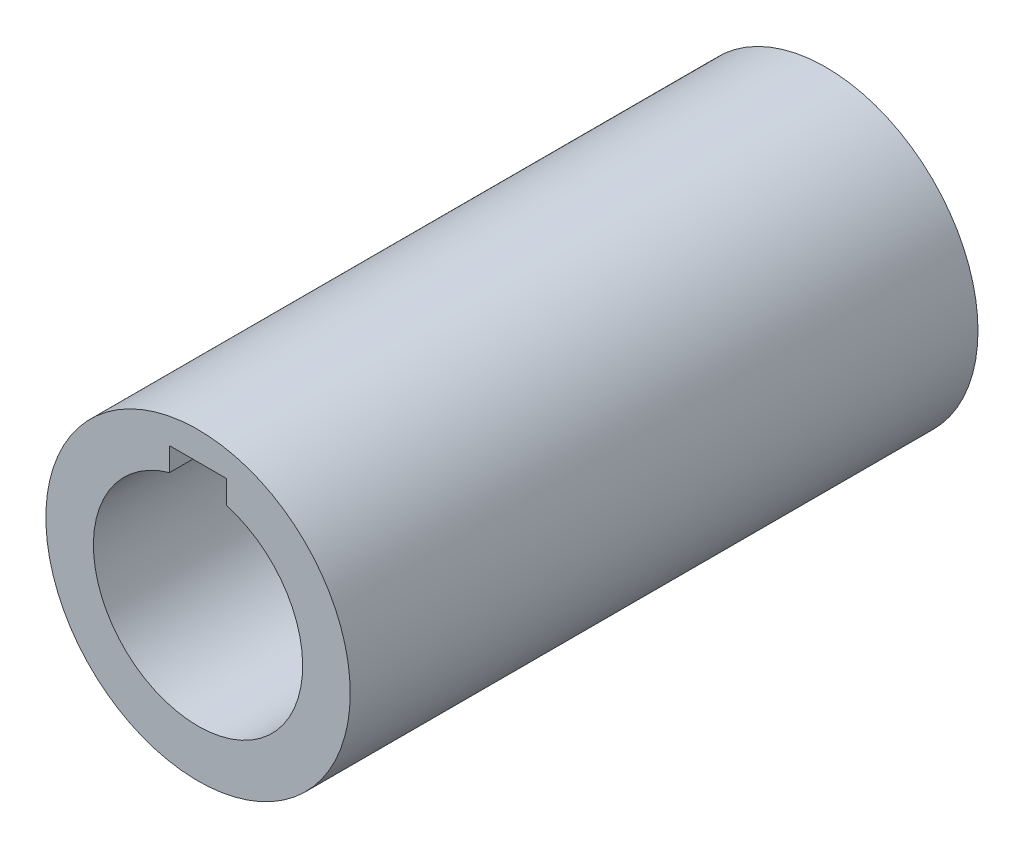
from build123d import *

# Parameters (mm, degrees)
BOSS_EXTRUDE1_DEPTH      = 33
BOSS_EXTRUDE1_DEPTH_BACK = 33
SKETCH1_R                = 16
SKETCH1_R_2              = 11
CUT_EXTRUDE1_DEPTH       = 33


with BuildPart() as part:
    # Sketch1 → Boss-Extrude1 (new, two sides: drawn at the far end of the back side and taken through both)
    with BuildSketch(Plane.XY.offset(-BOSS_EXTRUDE1_DEPTH_BACK)):
        Circle(SKETCH1_R)
        Circle(SKETCH1_R_2, mode=Mode.SUBTRACT)
    extrude(amount=BOSS_EXTRUDE1_DEPTH + BOSS_EXTRUDE1_DEPTH_BACK)

    # Sketch2 → Cut-Extrude1 (cut)
    with BuildSketch(Plane.XY.offset(33)):
        with BuildLine():
            Line((-3, 10.540195713), (-3, 13.040195713))
            Line((-3, 13.040195713), (0, 13.040195713))
            Line((0, 13.040195713), (3, 13.040195713))
            Line((3, 13.040195713), (3, 10.540195713))
            ThreePointArc((3, 10.540195713), (0, 10.958819538), (-3, 10.540195713))
        make_face()
    cut_extrude1 = extrude(amount=-CUT_EXTRUDE1_DEPTH, mode=Mode.SUBTRACT)

    # Mirror2: Cut-Extrude1 across plane
    add(cut_extrude1.mirror(Plane(origin=(0, 0, 0), x_dir=(1, 0, 0), z_dir=(0, 0, -1))), mode=Mode.SUBTRACT)


solid = part.part
